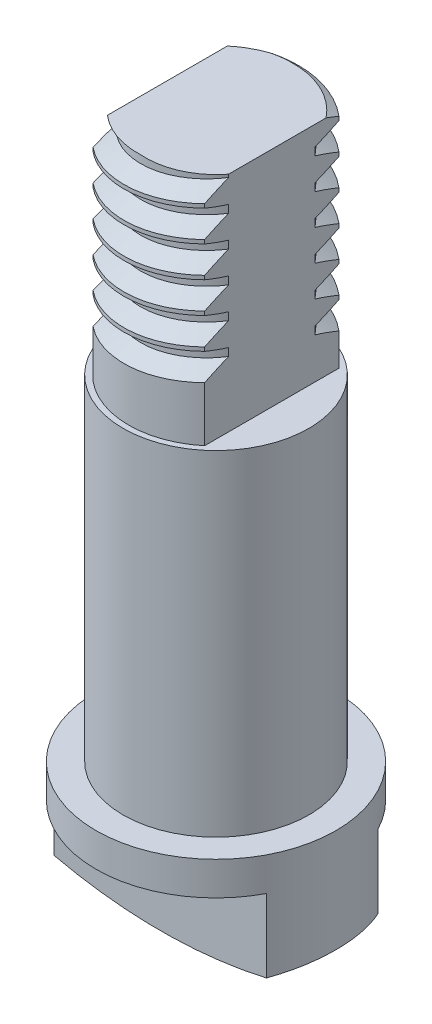
from build123d import *

# Parameters (mm, degrees)
SKETCH1_R           = 5.461
BOSS_EXTRUDE1_DEPTH = 1.524
SKETCH2_R           = 4.2291
BOSS_EXTRUDE2_DEPTH = 25.4
CUT_EXTRUDE1_START  = -10.16
SKETCH3_R           = 4.2291
SKETCH3_R_2         = 3.9751
CUT_EXTRUDE1_DEPTH  = 10.16
THREAD1_PITCH       = 1.411111111
CUT_EXTRUDE2_DEPTH  = 10.16
BOSS_EXTRUDE3_DEPTH = 2.54
CUT_EXTRUDE3_START  = -5.08
SKETCH8_R           = 7.312334108
SKETCH8_R_2         = 5.461
CUT_EXTRUDE3_DEPTH  = 5.08


with BuildPart() as part:
    # Sketch1 → Boss-Extrude1 (new body)
    with BuildSketch(Plane(origin=(0, 0, 0), x_dir=(1, 0, 0), z_dir=(0, 1, 0))):
        with Locations(Location((0, 0, 0), (0, 0, 90))):
            Circle(SKETCH1_R)
    extrude(amount=BOSS_EXTRUDE1_DEPTH)

    # Sketch2 → Boss-Extrude2 (add)
    with BuildSketch(Plane(origin=(0, 1.524, 0), x_dir=(1, 0, 0), z_dir=(0, 1, 0))):
        with Locations(Location((0, 0, 0), (0, 0, 270))):
            Circle(SKETCH2_R)
    extrude(amount=BOSS_EXTRUDE2_DEPTH)

    # Sketch3 → Cut-Extrude1 (cut)
    with BuildSketch(Plane(origin=(0, 26.924, 0), x_dir=(1, 0, 0), z_dir=(0, 1, 0)).offset(CUT_EXTRUDE1_START)):
        with Locations(Location((0, 0, 0), (0, 0, 270))):
            Circle(SKETCH3_R)
        with Locations(Location((0, 0, 0), (0, 0, 270))):
            Circle(SKETCH3_R_2, mode=Mode.SUBTRACT)
    extrude(amount=CUT_EXTRUDE1_DEPTH, mode=Mode.SUBTRACT)

    # Thread1: the profile of Thread Profile1 profile screwed along a right-hand helix of 9.9594 turns, 8 arcs to a turn; built about Z, then put on its axis
    thread1_z = Axis((0, 0, 0), (0, 0, 1))
    thread1_corners = [(3.9754, 0, -0.000173205), (3.9754, 0, 1.234895423), (3.21131371, 0, 0.793749998), (3.21131371, 0, 0.44097222)]
    with BuildLine(mode=Mode.PRIVATE) as thread1_profile:
        Line(thread1_corners[0], thread1_corners[1])
        Line(thread1_corners[1], thread1_corners[2])
        Line(thread1_corners[2], thread1_corners[3])
        Line(thread1_corners[3], thread1_corners[0])
    thread1_cap = Face(thread1_profile.wire())
    thread1_turn_angles = [0, 22.5, 45, 67.5, 90, 112.5, 135, 157.5, 180, 202.5, 225, 247.5, 270, 292.5, 315, 337.5, 360]
    thread1_turn_weights = [1, 0.9238795325112867, 1, 0.9238795325112867, 1, 0.9238795325112867, 1, 0.9238795325112867, 1, 0.9238795325112867, 1, 0.9238795325112867, 1, 0.9238795325112867, 1, 0.9238795325112867, 1]
    thread1_turn_rails = [Edge.make_bspline([Vector(p[0], p[1], 0).rotate(thread1_z, thread1_turn_angles[k]) / thread1_turn_weights[k] + Vector(0, 0, p[2] + THREAD1_PITCH * thread1_turn_angles[k] / 360) for k in range(17)], [0, 0, 0, 1, 1, 2, 2, 3, 3, 4, 4, 5, 5, 6, 6, 7, 7, 8, 8, 8], 2, thread1_turn_weights) for p in thread1_corners]
    thread1_turn_sides = [Face.make_surface_from_curves(thread1_turn_rails[p[0]], thread1_turn_rails[p[1]]) for p in [(0, 1), (1, 2), (2, 3), (3, 0)]]
    thread1_last_angles = [3240, 3262.5, 3285, 3307.5, 3330, 3352.5, 3375, 3397.5, 3420, 3442.5, 3465, 3487.5, 3510, 3532.5, 3555, 3570.192, 3585.384]
    thread1_last_weights = [1, 0.9238795325112867, 1, 0.9238795325112867, 1, 0.9238795325112867, 1, 0.9238795325112867, 1, 0.9238795325112867, 1, 0.9238795325112867, 1, 0.9238795325112867, 1, 0.9650530935808878, 1]
    thread1_last_rails = [Edge.make_bspline([Vector(p[0], p[1], 0).rotate(thread1_z, thread1_last_angles[k]) / thread1_last_weights[k] + Vector(0, 0, p[2] + THREAD1_PITCH * thread1_last_angles[k] / 360) for k in range(17)], [0, 0, 0, 1, 1, 2, 2, 3, 3, 4, 4, 5, 5, 6, 6, 7, 7, 8, 8, 8], 2, thread1_last_weights) for p in thread1_corners]
    thread1_last_sides = [Face.make_surface_from_curves(thread1_last_rails[p[0]], thread1_last_rails[p[1]]) for p in [(0, 1), (1, 2), (2, 3), (3, 0)]]
    thread1 = Plane(origin=(0, 18.034, 0), x_dir=(1, 0, 0), z_dir=(0, 1, 0)) * Solid(Shell([*[p.moved(Location((0, 0, THREAD1_PITCH * i))) for i in range(9) for p in thread1_turn_sides], *thread1_last_sides, thread1_cap, thread1_cap.rotate(thread1_z, 3585.384).moved(Location((0, 0, THREAD1_PITCH * 3585.384 / 360)))]))
    add(thread1, mode=Mode.SUBTRACT)

    # Sketch6 → Cut-Extrude2 (cut)
    with BuildSketch(Plane(origin=(0, 26.924, 0), x_dir=(1, 0, 0), z_dir=(0, 1, 0))):
        with BuildLine():
            Line((-2.54, -5.08), (-2.54, 5.08))
            ThreePointArc((-2.54, 5.08), (-5.679612663, 0), (-2.54, -5.08))
        make_face()
        with BuildLine():
            Line((2.54, -5.08), (2.54, 5.08))
            ThreePointArc((2.54, 5.08), (5.679612663, 0), (2.54, -5.08))
        make_face()
    extrude(amount=-CUT_EXTRUDE2_DEPTH, mode=Mode.SUBTRACT)

    # Sketch7 → Boss-Extrude3 (add, symmetric)
    with BuildSketch(Plane.XY):
        with BuildLine():
            Line((-5.461, 0), (5.461, 0))
            Line((5.461, 0), (5.461, -3.175))
            ThreePointArc((5.461, -3.175), (0, -3.877070974), (-5.461, -3.175))
            Line((-5.461, -3.175), (-5.461, 0))
        make_face()
    extrude(amount=BOSS_EXTRUDE3_DEPTH, both=True)

    # Sketch8 → Cut-Extrude3 (cut)
    with BuildSketch(Plane(origin=(0, 1.524, 0), x_dir=(1, 0, 0), z_dir=(0, 1, 0)).offset(CUT_EXTRUDE3_START)):
        Circle(SKETCH8_R)
        with Locations(Location((0, 0, 0), (0, 0, 27.71774769))):
            Circle(SKETCH8_R_2, mode=Mode.SUBTRACT)
    extrude(amount=CUT_EXTRUDE3_DEPTH, mode=Mode.SUBTRACT)


solid = part.part
